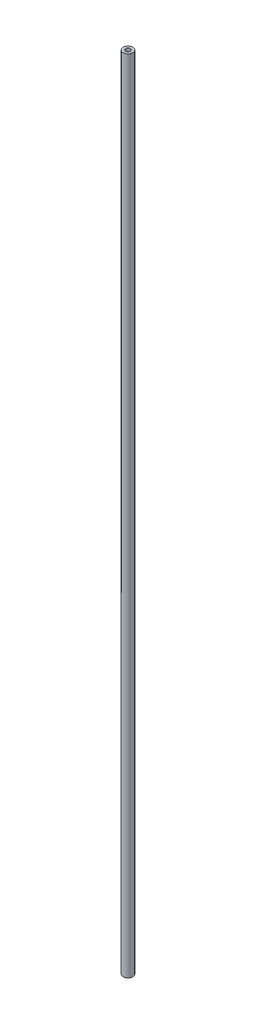
from build123d import *

# Parameters (mm, degrees)
SKETCH1_R           = 3
SKETCH1_R_2         = 1.5
BOSS_EXTRUDE1_DEPTH = 499.999999998


with BuildPart() as part:
    # Sketch1 → Boss-Extrude1 (new body)
    with BuildSketch(Plane(origin=(0, 0, 0), x_dir=(1, 0, 0), z_dir=(0, 1, 0))):
        Circle(SKETCH1_R)
        Circle(SKETCH1_R_2, mode=Mode.SUBTRACT)
    extrude(amount=BOSS_EXTRUDE1_DEPTH)


solid = part.part
